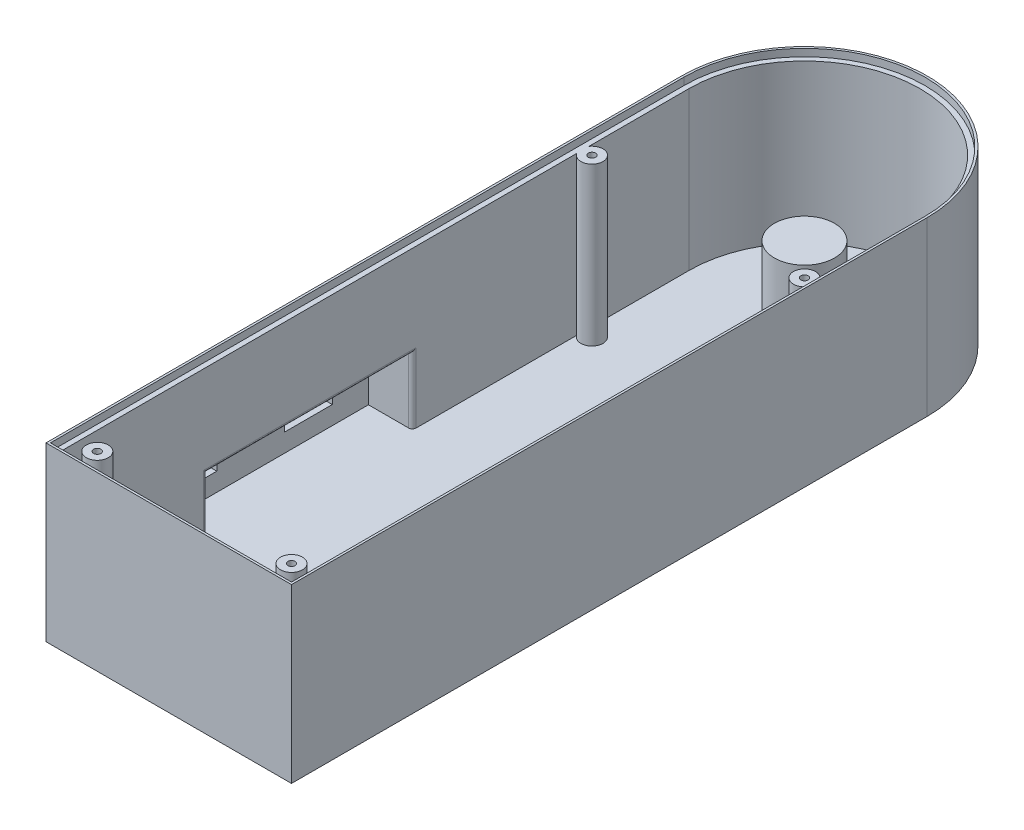
from build123d import *

# Parameters (mm, degrees)
SKETCH4_W                = 63
SKETCH4_H                = 43
BOSS_EXTRUDE2_DEPTH      = 173.5
SKETCH6_R                = 4
CUT_EXTRUDE1_DEPTH       = 3
SKETCH9_W                = 63
SKETCH9_H                = 43
CUT_EXTRUDE2_DEPTH       = 173.5
SKETCH10_R               = 8.2
BOSS_EXTRUDE3_DEPTH      = 22.8
SKETCH11_W               = 63
SKETCH11_H               = 43
BOSS_EXTRUDE4_DEPTH      = 2
SKETCH13_R               = 3
BOSS_EXTRUDE5_DEPTH      = 43
SKETCH14_R               = 1
CUT_EXTRUDE3_DEPTH       = 46
SKETCH15_R               = 4.3
CUT_EXTRUDE4_DEPTH       = 2
FILLET1_R                = 1
SKETCH19_R               = 6
CUT_EXTRUDE5_DEPTH       = 3
BOSS_EXTRUDE6_DEPTH      = 94
SKETCH21_W               = 37.035898385
SKETCH21_H               = 94
CUT_EXTRUDE6_DEPTH       = 13
FILLET2_R                = 1
BOSS_EXTRUDE8_DEPTH      = 2
SKETCH23_W               = 72.5
SKETCH23_H               = 25.3
CUT_EXTRUDE7_DEPTH       = 2
BOSS_EXTRUDE9_START      = -2
BOSS_EXTRUDE9_DEPTH      = 2
SKETCH25_R               = 3
BOSS_EXTRUDE10_DEPTH     = 48
SKETCH26_R               = 1
CUT_EXTRUDE8_DEPTH       = 46
SKETCH27_R               = 4.3
CUT_EXTRUDE9_DEPTH       = 2
FILLET3_R                = 1
SKETCH30_W               = 56
SKETCH30_H               = 18
CUT_EXTRUDE10_DEPTH      = 2
SKETCH31_W               = 60
SKETCH31_H               = 22
SKETCH31_W_2             = 56
SKETCH31_H_2             = 18
BOSS_EXTRUDE11_DEPTH     = 12
FILLET4_R                = 1
SKETCH33_W               = 56
SKETCH33_H               = 18
BOSS_EXTRUDE12_DEPTH     = 2
SKETCH34_W               = 1.256410256
SKETCH34_H               = 14
CUT_EXTRUDE11_DEPTH      = 1
SKETCH35_W               = 13.1
SKETCH35_H               = 12
SKETCH35_W_2             = 9.9
SKETCH35_H_2             = 11.8
CUT_EXTRUDE12_DEPTH      = 2
FILLET5_R                = 1
CUT_EXTRUDE13_DEPTH      = 186.67848556
CUT_EXTRUDE13_DEPTH_BACK = 3
FILLET6_R                = 1
SKETCH37_W               = 140.841687605
SKETCH37_H               = 2
BOSS_EXTRUDE13_DEPTH     = 4
FILLET8_R                = 2
SKETCH38_W               = 101.517619225
SKETCH38_H               = 238.576301881
CUT_EXTRUDE14_DEPTH      = 100
BOSS_EXTRUDE14_DEPTH     = 2


with BuildPart() as part:
    # Sketch1 → Revolve1 (revolve)
    with BuildSketch(Plane.XY, mode=Mode.PRIVATE) as revolve1_sk:
        Polygon((-31.5, 48), (-31.5, 50), (-33.5, 50), (-33.5, 0), (0, 0), (0, 24.8), (-8.2, 24.8), (-8.2, 2), (-31.5, 2), (-31.5, 45), (-4, 45), (-4, 48), align=None)
    revolve(revolve1_sk.sketch.rotate(Axis((0, 0, 0), (0, 1, 0)), 270), axis=Axis((0, 0, 0), (0, 1, 0)))

    # Sketch4 → Boss-Extrude2 (add)
    with BuildSketch(Plane.XY):
        Polygon((33.5, 0), (-33.5, 0), (-33.5, 48), (-31.5, 48), (31.5, 48), (33.5, 48), align=None)
        with Locations((0, 23.5)):
            Rectangle(SKETCH4_W, SKETCH4_H, mode=Mode.SUBTRACT)
    extrude(amount=BOSS_EXTRUDE2_DEPTH)

    # Sketch6 → Cut-Extrude1 (cut)
    with BuildSketch(Plane(origin=(0, 48, 0), x_dir=(1, 0, 0), z_dir=(0, 1, 0))):
        with Locations(Location((0, 0, 0), (0, 0, 90))):
            Circle(SKETCH6_R)
    extrude(amount=-CUT_EXTRUDE1_DEPTH, mode=Mode.SUBTRACT)

    # Sketch9 → Cut-Extrude2 (cut)
    with BuildSketch(Plane.XY.offset(173.5)):
        with Locations((0, 23.5)):
            Rectangle(SKETCH9_W, SKETCH9_H)
    extrude(amount=-CUT_EXTRUDE2_DEPTH, mode=Mode.SUBTRACT)

    # Sketch10 → Boss-Extrude3 (add)
    with BuildSketch(Plane(origin=(0, 2, 0), x_dir=(1, 0, 0), z_dir=(0, 1, 0))):
        with Locations(Location((0, 0, 0), (0, 0, 90))):
            Circle(SKETCH10_R)
    extrude(amount=BOSS_EXTRUDE3_DEPTH)

    # Sketch11 → Boss-Extrude4 (add)
    with BuildSketch(Plane.XY.offset(173.5)):
        with Locations((0, 23.5)):
            Rectangle(SKETCH11_W, SKETCH11_H)
    extrude(amount=-BOSS_EXTRUDE4_DEPTH)

    # Sketch13 → Boss-Extrude5 (add)
    with BuildSketch(Plane(origin=(0, 2, 0), x_dir=(1, 0, 0), z_dir=(0, 1, 0))):
        with Locations(Location((-26.5, -166.5, 0), (0, 0, 90))):
            Circle(SKETCH13_R)
        with Locations(Location((26.5, -166.5, 0), (0, 0, 90))):
            Circle(SKETCH13_R)
    extrude(amount=BOSS_EXTRUDE5_DEPTH)

    # Sketch14 → Cut-Extrude3 (cut)
    with BuildSketch(Plane(origin=(0, 2, 0), x_dir=(1, 0, 0), z_dir=(0, 1, 0))):
        with Locations(Location((-26.5, -166.5, 0), (0, 0, 270))):
            Circle(SKETCH14_R)
        with Locations(Location((26.5, -166.5, 0), (0, 0, 270))):
            Circle(SKETCH14_R)
    extrude(amount=CUT_EXTRUDE3_DEPTH, mode=Mode.SUBTRACT)

    # Sketch15 → Cut-Extrude4 (cut)
    with BuildSketch(Plane(origin=(0, 48, 0), x_dir=(1, 0, 0), z_dir=(0, 1, 0))):
        with Locations(Location((-26.5, -166.5, 0), (0, 0, 270))):
            Circle(SKETCH15_R)
        with Locations(Location((26.5, -166.5, 0), (0, 0, 270))):
            Circle(SKETCH15_R)
    extrude(amount=-CUT_EXTRUDE4_DEPTH, mode=Mode.SUBTRACT)

    # Fillet1
    fillet1_edges = [part.edges().sort_by_distance(p)[0] for p in [
        (-26.5, 46, 162.2),
        (26.5, 46, 162.2),
    ]]
    fillet(fillet1_edges, radius=FILLET1_R)

    # Sketch19 → Cut-Extrude5 (cut)
    with BuildSketch(Plane(origin=(0, 48, 0), x_dir=(1, 0, 0), z_dir=(0, 1, 0))):
        with Locations(Location((16.75, -51, 0), (0, 0, 270))):
            Circle(SKETCH19_R)
        with Locations(Location((16.75, -86, 0), (0, 0, 270))):
            Circle(SKETCH19_R)
        with Locations(Location((16.75, -121, 0), (0, 0, 270))):
            Circle(SKETCH19_R)
        with Locations(Location((16.75, -156, 0), (0, 0, 270))):
            Circle(SKETCH19_R)
    extrude(amount=-CUT_EXTRUDE5_DEPTH, mode=Mode.SUBTRACT)

    # Sketch20 → Boss-Extrude6 (add)
    with BuildSketch(Plane.XY.offset(56.5)):
        Polygon((9, 48), (-11.207259422, 83), (-33.5, 83), (-33.5, 48), align=None)
        Polygon((5.535898385, 50), (-12.36195996, 81), (-31.5, 81), (-31.5, 50), align=None, mode=Mode.SUBTRACT)
    extrude(amount=BOSS_EXTRUDE6_DEPTH)

    # Sketch21 → Cut-Extrude6 (cut)
    with BuildSketch(Plane(origin=(0, 50, 0), x_dir=(1, 0, 0), z_dir=(0, 1, 0))):
        with Locations((-12.982050808, -103.5)):
            Rectangle(SKETCH21_W, SKETCH21_H)
    extrude(amount=-CUT_EXTRUDE6_DEPTH, mode=Mode.SUBTRACT)

    # Fillet2
    fillet2_edges = [part.edges().sort_by_distance(p)[0] for p in [
        (-11.207259422, 83, 103.5),
        (-33.5, 83, 103.5),
    ]]
    fillet(fillet2_edges, radius=FILLET2_R)

    # Sketch22 → Boss-Extrude8 (add)
    with BuildSketch(Plane.XY.offset(150.5)):
        with BuildLine():
            Line((-33.5, 48), (-33.5, 45))
            Line((-33.5, 45), (9, 45))
            Line((9, 45), (9, 48))
            Line((9, 48), (-10.918584287, 82.5))
            ThreePointArc((-10.918584287, 82.5), (-11.284609691, 82.866025404), (-11.784609691, 83))
            Line((-11.784609691, 83), (-32.5, 83))
            ThreePointArc((-32.5, 83), (-33.207106781, 82.707106781), (-33.5, 82))
            Line((-33.5, 82), (-33.5, 48))
        make_face()
    extrude(amount=-BOSS_EXTRUDE8_DEPTH)

    # Sketch23 → Cut-Extrude7 (cut)
    with BuildSketch(Plane(origin=(27.534609691, 15.897114317, 0), x_dir=(0, 0, -1), z_dir=(0.8660254037844364, 0.5000000000000041, 0))):
        with Locations((-103.5, 54.719219382)):
            Rectangle(SKETCH23_W, SKETCH23_H)
    extrude(amount=-CUT_EXTRUDE7_DEPTH, mode=Mode.SUBTRACT)

    # Sketch24 → Boss-Extrude9 (add)
    with BuildSketch(Plane(origin=(0, 0, 56.5), x_dir=(-1, 0, 0), z_dir=(0, 0, -1)).offset(BOSS_EXTRUDE9_START)):
        with BuildLine():
            Line((-9, 48), (-9, 45))
            Line((-9, 45), (33.5, 45))
            Line((33.5, 45), (33.5, 82))
            ThreePointArc((33.5, 82), (33.207106781, 82.707106781), (32.5, 83))
            Line((32.5, 83), (11.784609691, 83))
            ThreePointArc((11.784609691, 83), (11.284609691, 82.866025404), (10.918584287, 82.5))
            Line((10.918584287, 82.5), (-9, 48))
        make_face()
    extrude(amount=BOSS_EXTRUDE9_DEPTH)

    # Sketch25 → Boss-Extrude10 (add)
    with BuildSketch(Plane(origin=(0, 48, 0), x_dir=(1, 0, 0), z_dir=(0, 1, 0))):
        with Locations((29, -29)):
            Circle(SKETCH25_R)
        with Locations((-29, -29)):
            Circle(SKETCH25_R)
    extrude(amount=-BOSS_EXTRUDE10_DEPTH)

    # Sketch26 → Cut-Extrude8 (cut)
    with BuildSketch(Plane(origin=(0, 48, 0), x_dir=(1, 0, 0), z_dir=(0, 1, 0))):
        with Locations(Location((29, -29, 0), (0, 0, 270))):
            Circle(SKETCH26_R)
        with Locations(Location((-29, -29, 0), (0, 0, 270))):
            Circle(SKETCH26_R)
    extrude(amount=-CUT_EXTRUDE8_DEPTH, mode=Mode.SUBTRACT)

    # Sketch27 → Cut-Extrude9 (cut)
    with BuildSketch(Plane(origin=(0, 48, 0), x_dir=(1, 0, 0), z_dir=(0, 1, 0))):
        with Locations(Location((-29, -29, 0), (0, 0, 270))):
            Circle(SKETCH27_R)
        with Locations(Location((29, -29, 0), (0, 0, 270))):
            Circle(SKETCH27_R)
    extrude(amount=-CUT_EXTRUDE9_DEPTH, mode=Mode.SUBTRACT)

    # Fillet3
    fillet3_edges = [part.edges().sort_by_distance(p)[0] for p in [
        (-29, 46, 24.7),
        (29, 46, 24.7),
    ]]
    fillet(fillet3_edges, radius=FILLET3_R)

    # Sketch30 → Cut-Extrude10 (cut)
    with BuildSketch(Plane.ZY.offset(33.5)):
        with Locations((103.5, 11)):
            Rectangle(SKETCH30_W, SKETCH30_H)
    extrude(amount=-CUT_EXTRUDE10_DEPTH, mode=Mode.SUBTRACT)

    # Sketch31 → Boss-Extrude11 (add)
    with BuildSketch(Plane.ZY.offset(33.5)):
        with Locations((103.5, 11)):
            Rectangle(SKETCH31_W, SKETCH31_H)
        with Locations((103.5, 11)):
            Rectangle(SKETCH31_W_2, SKETCH31_H_2, mode=Mode.SUBTRACT)
    extrude(amount=BOSS_EXTRUDE11_DEPTH)

    # Fillet4
    fillet4_edges = [part.edges().sort_by_distance(p)[0] for p in [
        (-33.5, 22, 103.5),
        (-33.5, 11, 73.5),
        (-33.5, 11, 133.5),
    ]]
    fillet(fillet4_edges, radius=FILLET4_R)

    # Sketch33 → Boss-Extrude12 (add)
    with BuildSketch(Plane.ZY.offset(45.5)):
        with Locations((103.5, 11)):
            Rectangle(SKETCH33_W, SKETCH33_H)
    extrude(amount=-BOSS_EXTRUDE12_DEPTH)

    # Sketch34 → Cut-Extrude11 (cut)
    # profile 1 of 6: a face of its own
    with BuildSketch(Plane(origin=(-88.690997647, 83, 0), x_dir=(0, 0, -1), z_dir=(0, -1, 0))):
        with Locations((-131.948717949, 66.906387956)):
            Rectangle(SKETCH34_W, SKETCH34_H)
    # profile 2 of 6: a face of its own
    with BuildSketch(Plane(origin=(-88.690997647, 83, 0), x_dir=(0, 0, -1), z_dir=(0, -1, 0))):
        with BuildLine():
            add(Edge.make_bspline(
                [(-127.282051282, 71.752541802), (-127.204036474, 71.757021384), (-127.05199672, 71.765751451), (-126.831838559, 71.829913099), (-126.630653738, 71.938172272), (-126.452556555, 72.086921483), (-126.304534975, 72.264507803), (-126.195030127, 72.46518156), (-126.127927486, 72.68597799), (-126.119633012, 72.84021095), (-126.115384615, 72.919208469)],
                knots=[0, 0, 0, 0, 1.020591893, 1.988988293, 2.974634352, 3.991697318, 5.008760285, 5.983632262, 6.967224335, 8, 8, 8, 8], degree=3))
            add(Edge.make_bspline(
                [(-126.115384615, 72.919208469), (-126.119787901, 72.996319721), (-126.128486105, 73.148644483), (-126.195061577, 73.367578068), (-126.30439614, 73.56847965), (-126.453493838, 73.745645733), (-126.6295776, 73.897974931), (-126.832476342, 74.004732003), (-127.051429094, 74.073595456), (-127.203934167, 74.081715722), (-127.282051282, 74.085875135)],
                knots=[0, 0, 0, 0, 1.010056097, 1.99525427, 2.971718109, 3.990441831, 5.01702829, 6.004283803, 6.977741589, 8, 8, 8, 8], degree=3))
            add(Edge.make_bspline(
                [(-127.282051282, 74.085875135), (-127.360112179, 74.081559045), (-127.513404007, 74.073083337), (-127.73317612, 74.006101082), (-127.934845679, 73.896933206), (-128.11097521, 73.745920643), (-128.258874388, 73.567557044), (-128.373284839, 73.368945884), (-128.434548495, 73.148011315), (-128.443950276, 72.996195002), (-128.448717949, 72.919208469)],
                knots=[0, 0, 0, 0, 1.021821805, 2.006599202, 2.982645994, 4.008793999, 5.027082625, 6.009034913, 6.990375297, 8, 8, 8, 8], degree=3))
            add(Edge.make_bspline(
                [(-128.448717949, 72.919208469), (-128.444092294, 72.840340078), (-128.435076647, 72.686621378), (-128.373312706, 72.463815008), (-128.258735298, 72.265431373), (-128.111909392, 72.086648721), (-127.933780412, 71.939197607), (-127.733801774, 71.828562965), (-127.51284526, 71.76625627), (-127.360012131, 71.757174469), (-127.282051282, 71.752541802)],
                knots=[0, 0, 0, 0, 1.032329927, 2.012066096, 2.992413168, 4.009037178, 5.025661188, 6.000112418, 6.979848586, 8, 8, 8, 8], degree=3))
        make_face()
    # profile 3 of 6: a face of its own
    with BuildSketch(Plane(origin=(-88.690997647, 83, 0), x_dir=(0, 0, -1), z_dir=(0, -1, 0))):
        Polygon((-122.884615385, 59.906387956), (-121.628205128, 59.906387956), (-121.628205128, 65.649977699), (-114.448717949, 65.649977699), (-114.448717949, 59.906387956), (-113.192307692, 59.906387956), (-113.192307692, 73.906387956), (-114.448717949, 73.906387956), (-114.448717949, 67.085875135), (-121.628205128, 67.085875135), (-121.628205128, 73.906387956), (-122.884615385, 73.906387956), align=None)
    # profile 4 of 6: a face of its own
    with BuildSketch(Plane(origin=(-88.690997647, 83, 0), x_dir=(0, 0, -1), z_dir=(0, -1, 0))):
        with BuildLine():
            Line((-99.551282051, 63.675618725), (-99.551282051, 73.906387956))
            Line((-99.551282051, 73.906387956), (-100.807692308, 73.906387956))
            Line((-100.807692308, 73.906387956), (-100.807692308, 72.136756545))
            add(Edge.make_bspline(
                [(-100.807692308, 72.136756545), (-100.949559408, 72.296694095), (-101.226826553, 72.609278391), (-101.685478933, 73.020163), (-102.175666693, 73.355630058), (-102.689038567, 73.627929327), (-103.229568228, 73.833193668), (-103.794081172, 73.977799853), (-104.382135708, 74.071868231), (-104.783157032, 74.081164279), (-104.986378205, 74.085875135)],
                knots=[0, 0, 0, 0, 1.074235403, 2.099501444, 3.086304576, 4.053325556, 5.01427503, 5.985443889, 6.979105517, 8, 8, 8, 8], degree=3))
            add(Edge.make_bspline(
                [(-104.986378205, 74.085875135), (-105.167050511, 74.08097046), (-105.523344299, 74.071298224), (-106.047453548, 73.996237304), (-106.551848614, 73.875758039), (-107.036850958, 73.707995401), (-107.499174292, 73.486612277), (-107.941423686, 73.21870812), (-108.36463127, 72.902801794), (-108.760748522, 72.540247251), (-109.125978444, 72.14687795), (-109.445517738, 71.726092193), (-109.716337693, 71.283669461), (-109.938903193, 70.8197341), (-110.111136046, 70.334625248), (-110.23096351, 69.828675698), (-110.305943543, 69.302727324), (-110.315610879, 68.944567704), (-110.320512821, 68.762958469)],
                knots=[0, 0, 0, 0, 1.034036272, 2.039165313, 3.024406509, 3.999331371, 4.971254918, 5.953351348, 6.95522652, 7.989525907, 9.023492927, 10.024309745, 11.009187477, 11.988246066, 12.964946762, 13.950187958, 14.960617622, 16, 16, 16, 16], degree=3))
            add(Edge.make_bspline(
                [(-110.320512821, 68.762958469), (-110.315502156, 68.585102896), (-110.305596342, 68.233492024), (-110.23176582, 67.716388188), (-110.107706917, 67.2182747), (-109.933274241, 66.740996758), (-109.710590389, 66.282632207), (-109.435112943, 65.846767298), (-109.115688796, 65.426734526), (-108.74655549, 65.036003596), (-108.34688294, 64.676390503), (-107.921307552, 64.359716463), (-107.475135823, 64.092499188), (-107.007473118, 63.875277522), (-106.5216309, 63.702659962), (-106.013918487, 63.582328903), (-105.48664475, 63.511593502), (-105.128686543, 63.501335053), (-104.947115385, 63.496131545)],
                knots=[0, 0, 0, 0, 1.02050356, 2.017480486, 2.990790918, 3.96161403, 4.928589988, 5.909588639, 6.91611943, 7.952353252, 8.989586576, 9.99823133, 10.991940466, 11.968822692, 12.952985106, 13.945868367, 14.958059758, 16, 16, 16, 16], degree=3))
            add(Edge.make_bspline(
                [(-104.947115385, 63.496131545), (-104.738311782, 63.501860959), (-104.328857772, 63.513096067), (-103.729112136, 63.607392592), (-103.161484658, 63.765224909), (-102.621058799, 63.980649759), (-102.115429291, 64.270750367), (-101.639735311, 64.629702222), (-101.199621142, 65.066207485), (-100.9405952, 65.398270363), (-100.807692308, 65.568647571)],
                knots=[0, 0, 0, 0, 1.038908319, 2.037250181, 3.012632028, 3.966567879, 4.9252131, 5.905168122, 6.925168603, 8, 8, 8, 8], degree=3))
            Line((-100.807692308, 65.568647571), (-100.807692308, 63.675618725))
            Line((-100.807692308, 63.675618725), (-99.551282051, 63.675618725))
        make_face()
        with BuildLine():
            add(Edge.make_bspline(
                [(-104.930288462, 64.752541802), (-105.113941971, 64.759081875), (-105.476444788, 64.771990938), (-106.008676356, 64.872605062), (-106.517721233, 65.040443519), (-107.002751616, 65.268659247), (-107.450376696, 65.560996553), (-107.857064896, 65.905684904), (-108.211791596, 66.306947393), (-108.511723002, 66.755564948), (-108.760721655, 67.233621452), (-108.932550065, 67.737000467), (-109.046679273, 68.252096677), (-109.058279678, 68.601563937), (-109.064102564, 68.776980904)],
                knots=[0, 0, 0, 0, 1.031179624, 2.035384561, 3.030098214, 4.035455833, 5.037557836, 6.024646278, 7.02156144, 8.035264006, 9.049836703, 10.039645228, 11.015989397, 12, 12, 12, 12], degree=3))
            add(Edge.make_bspline(
                [(-109.064102564, 68.776980904), (-109.05654374, 68.951306689), (-109.04145572, 69.299274959), (-108.936056281, 69.815160534), (-108.751049717, 70.315255398), (-108.507497803, 70.799474277), (-108.202845091, 71.251438033), (-107.848818519, 71.660109619), (-107.440066701, 72.010111329), (-106.988500009, 72.303274908), (-106.506714423, 72.539101452), (-105.999879604, 72.705430661), (-105.476829524, 72.810449466), (-105.120547678, 72.823105087), (-104.94150641, 72.829464879)],
                knots=[0, 0, 0, 0, 0.979235476, 1.954632679, 2.943119654, 3.967171814, 4.992637064, 5.997548408, 6.995574264, 8.005058949, 9.015076297, 9.999929117, 10.994910263, 12, 12, 12, 12], degree=3))
            add(Edge.make_bspline(
                [(-104.94150641, 72.829464879), (-104.759723293, 72.82284818), (-104.399094225, 72.809721692), (-103.865022351, 72.708413684), (-103.347692816, 72.538491195), (-102.851318684, 72.307106954), (-102.389689733, 72.020246776), (-101.97729874, 71.682924863), (-101.621032586, 71.296628225), (-101.327706123, 70.863665084), (-101.093342241, 70.394243496), (-100.927394835, 69.892855662), (-100.826604225, 69.362481009), (-100.814083445, 68.998983698), (-100.807692308, 68.813439238)],
                knots=[0, 0, 0, 0, 1.017730373, 2.019016736, 3.032373701, 4.060729657, 5.079187105, 6.068726676, 7.03591854, 8.011858086, 8.988317194, 9.965225429, 10.961364673, 12, 12, 12, 12], degree=3))
            add(Edge.make_bspline(
                [(-100.807692308, 68.813439238), (-100.811530994, 68.67208797), (-100.819086743, 68.393863944), (-100.876808154, 67.985353095), (-100.968631033, 67.594421044), (-101.098004164, 67.220639903), (-101.268012245, 66.866138453), (-101.472841465, 66.528137895), (-101.716693177, 66.209786658), (-101.992146351, 65.911487906), (-102.297054473, 65.64077053), (-102.621284743, 65.402162507), (-102.964021402, 65.200234462), (-103.325023868, 65.038639209), (-103.701511674, 64.906991608), (-104.097093385, 64.820040643), (-104.507782261, 64.760144848), (-104.787970212, 64.755102835), (-104.930288462, 64.752541802)],
                knots=[0, 0, 0, 0, 1.050062701, 2.066855696, 3.059271411, 4.030305351, 4.999747758, 5.975466543, 6.961907836, 7.974539719, 8.98812422, 9.98710676, 10.961662635, 11.93785114, 12.922015094, 13.919620009, 14.94329489, 16, 16, 16, 16], degree=3))
        make_face(mode=Mode.SUBTRACT)
    # profile 5 of 6: a face of its own
    with BuildSketch(Plane(origin=(-88.690997647, 83, 0), x_dir=(0, 0, -1), z_dir=(0, -1, 0))):
        with BuildLine():
            Line((-96.679487179, 63.675618725), (-95.423076923, 63.675618725))
            Line((-95.423076923, 63.675618725), (-95.423076923, 65.520971289))
            add(Edge.make_bspline(
                [(-95.423076923, 65.520971289), (-95.289157957, 65.353350137), (-95.029691705, 65.02858634), (-94.59314516, 64.60509757), (-94.137956996, 64.249722748), (-93.656734238, 63.969916172), (-93.154428772, 63.758297763), (-92.632465882, 63.605695951), (-92.088020434, 63.514140011), (-91.717760861, 63.502181358), (-91.530448718, 63.496131545)],
                knots=[0, 0, 0, 0, 1.127869841, 2.185233117, 3.191641716, 4.159226741, 5.10472073, 6.052603964, 7.014823782, 8, 8, 8, 8], degree=3))
            add(Edge.make_bspline(
                [(-91.530448718, 63.496131545), (-91.341035811, 63.502717968), (-90.970123229, 63.515615649), (-90.432020324, 63.629261075), (-89.925930257, 63.809105693), (-89.458620286, 64.061868442), (-89.037280928, 64.375689687), (-88.671907889, 64.743804343), (-88.364647734, 65.161777592), (-88.15956584, 65.553010358), (-88.02692105, 65.900525254), (-87.939752105, 66.197763901), (-87.869230571, 66.529058154), (-87.806040534, 66.893588904), (-87.763885841, 67.292820282), (-87.730470414, 67.725799431), (-87.706569282, 68.192451381), (-87.705618498, 68.515197399), (-87.705128205, 68.68162834)],
                knots=[0, 0, 0, 0, 1.235764162, 2.419900973, 3.574701258, 4.732869372, 5.875730734, 6.993815468, 8.107424371, 9.251605764, 9.866123335, 10.534503958, 11.272175692, 12.077112099, 12.949509943, 13.89253218, 14.913238789, 16, 16, 16, 16], degree=3))
            Line((-87.705128205, 68.68162834), (-87.705128205, 73.906387956))
            Line((-87.705128205, 73.906387956), (-88.961538462, 73.906387956))
            Line((-88.961538462, 73.906387956), (-88.961538462, 69.093887956))
            add(Edge.make_bspline(
                [(-88.961538462, 69.093887956), (-88.962308095, 68.954597976), (-88.963780274, 68.68815995), (-88.968484365, 68.306686454), (-88.979557576, 67.961664657), (-88.995757207, 67.652102998), (-89.018432601, 67.379134492), (-89.042707021, 67.141377431), (-89.07214832, 66.940937808), (-89.098401967, 66.820277635), (-89.110176282, 66.766163597)],
                knots=[0, 0, 0, 0, 1.430803381, 2.736883362, 3.918614142, 4.976458302, 5.92063272, 6.731858525, 7.431260095, 8, 8, 8, 8], degree=3))
            add(Edge.make_bspline(
                [(-89.110176282, 66.766163597), (-89.152467435, 66.60720474), (-89.233648341, 66.302071799), (-89.438328407, 65.888890398), (-89.69079908, 65.534265166), (-90.003604456, 65.245489432), (-90.368343351, 65.020684953), (-90.785622116, 64.864823406), (-91.251122123, 64.767308391), (-91.578541768, 64.757601307), (-91.749198718, 64.752541802)],
                knots=[0, 0, 0, 0, 1.084232, 2.08126119, 3.027460722, 3.945137793, 4.874029258, 5.839697328, 6.874011781, 8, 8, 8, 8], degree=3))
            add(Edge.make_bspline(
                [(-91.749198718, 64.752541802), (-91.850278792, 64.754417715), (-92.050313648, 64.758130098), (-92.346777346, 64.796345108), (-92.635253712, 64.856700904), (-92.914969902, 64.945850548), (-93.186491199, 65.05424406), (-93.450941222, 65.187247995), (-93.70462484, 65.348127535), (-93.951109207, 65.528956343), (-94.180206001, 65.730331925), (-94.396414837, 65.939748523), (-94.58638105, 66.165974926), (-94.758817282, 66.401012527), (-94.907487653, 66.649582736), (-95.037311441, 66.90902848), (-95.147451161, 67.179760147), (-95.202182341, 67.367659979), (-95.229567308, 67.461676417)],
                knots=[0, 0, 0, 0, 1.023939463, 2.026349741, 3.024227553, 4.007104963, 4.997624259, 5.984875705, 7.002218968, 8.038748769, 9.079772093, 10.091408226, 11.086177727, 12.069739863, 13.043026652, 14.017557731, 15.008077027, 16, 16, 16, 16], degree=3))
            add(Edge.make_bspline(
                [(-95.229567308, 67.461676417), (-95.245325902, 67.530697229), (-95.279631537, 67.680951927), (-95.316684257, 67.927529605), (-95.350314558, 68.212769505), (-95.378462393, 68.536338773), (-95.395684059, 68.899370273), (-95.414461646, 69.300313625), (-95.42129789, 69.740767578), (-95.422467306, 70.047414349), (-95.423076923, 70.207269366)],
                knots=[0, 0, 0, 0, 0.615963638, 1.340920617, 2.168419149, 3.115676021, 4.16674242, 5.331190069, 6.6087489, 8, 8, 8, 8], degree=3))
            Line((-95.423076923, 70.207269366), (-95.423076923, 73.906387956))
            Line((-95.423076923, 73.906387956), (-96.679487179, 73.906387956))
            Line((-96.679487179, 73.906387956), (-96.679487179, 63.675618725))
        make_face()
    # profile 6 of 6: a face of its own
    with BuildSketch(Plane(origin=(-88.690997647, 83, 0), x_dir=(0, 0, -1), z_dir=(0, -1, 0))):
        with BuildLine():
            Line((-74.423076923, 59.547413597), (-74.423076923, 73.906387956))
            Line((-74.423076923, 73.906387956), (-75.679487179, 73.906387956))
            Line((-75.679487179, 73.906387956), (-75.679487179, 72.136756545))
            add(Edge.make_bspline(
                [(-75.679487179, 72.136756545), (-75.82135428, 72.296694095), (-76.098621425, 72.609278391), (-76.557273805, 73.020163), (-77.047461565, 73.355630058), (-77.560833439, 73.627929327), (-78.101363099, 73.833193668), (-78.665876043, 73.977799853), (-79.25393058, 74.071868231), (-79.654951904, 74.081164279), (-79.858173077, 74.085875135)],
                knots=[0, 0, 0, 0, 1.074235403, 2.099501444, 3.086304576, 4.053325556, 5.01427503, 5.985443889, 6.979105517, 8, 8, 8, 8], degree=3))
            add(Edge.make_bspline(
                [(-79.858173077, 74.085875135), (-80.038845383, 74.08097046), (-80.395139171, 74.071298224), (-80.91924842, 73.996237304), (-81.423643486, 73.875758039), (-81.90864583, 73.707995401), (-82.370969164, 73.486612277), (-82.813218558, 73.21870812), (-83.236426142, 72.902801794), (-83.632543394, 72.540247251), (-83.997773316, 72.14687795), (-84.31731261, 71.726092193), (-84.588132565, 71.283669461), (-84.810698064, 70.8197341), (-84.982930918, 70.334625248), (-85.102758382, 69.828675698), (-85.177738414, 69.302727324), (-85.187405751, 68.944567704), (-85.192307692, 68.762958469)],
                knots=[0, 0, 0, 0, 1.034036272, 2.039165313, 3.024406509, 3.999331371, 4.971254918, 5.953351348, 6.95522652, 7.989525907, 9.023492927, 10.024309745, 11.009187477, 11.988246066, 12.964946762, 13.950187958, 14.960617622, 16, 16, 16, 16], degree=3))
            add(Edge.make_bspline(
                [(-85.192307692, 68.762958469), (-85.187297028, 68.585102896), (-85.177391214, 68.233492024), (-85.103560692, 67.716388188), (-84.979501789, 67.2182747), (-84.805069113, 66.740996758), (-84.582385261, 66.282632207), (-84.306907815, 65.846767298), (-83.987483668, 65.426734526), (-83.618350361, 65.036003596), (-83.218677812, 64.676390503), (-82.793102423, 64.359716463), (-82.346930695, 64.092499188), (-81.879267989, 63.875277522), (-81.393425772, 63.702659962), (-80.885713359, 63.582328903), (-80.358439621, 63.511593502), (-80.000481415, 63.501335053), (-79.818910256, 63.496131545)],
                knots=[0, 0, 0, 0, 1.02050356, 2.017480486, 2.990790918, 3.96161403, 4.928589988, 5.909588639, 6.91611943, 7.952353252, 8.989586576, 9.99823133, 10.991940466, 11.968822692, 12.952985106, 13.945868367, 14.958059758, 16, 16, 16, 16], degree=3))
            add(Edge.make_bspline(
                [(-79.818910256, 63.496131545), (-79.610011355, 63.502290764), (-79.199966026, 63.514380625), (-78.600202205, 63.618863482), (-78.030823851, 63.786104789), (-77.49185283, 64.023662608), (-76.98802002, 64.333257117), (-76.512590236, 64.705577492), (-76.072848113, 65.149983962), (-75.812606589, 65.484482914), (-75.679487179, 65.655586674)],
                knots=[0, 0, 0, 0, 1.03083325, 2.023411113, 2.996083796, 3.9549903, 4.922369457, 5.908572979, 6.930187902, 8, 8, 8, 8], degree=3))
            Line((-75.679487179, 65.655586674), (-75.679487179, 59.547413597))
            Line((-75.679487179, 59.547413597), (-74.423076923, 59.547413597))
        make_face()
        with BuildLine():
            add(Edge.make_bspline(
                [(-79.802083333, 64.752541802), (-79.985736843, 64.759081875), (-80.34823966, 64.771990938), (-80.880471228, 64.872605062), (-81.389516104, 65.040443519), (-81.874546487, 65.268659247), (-82.322171568, 65.560996553), (-82.728859768, 65.905684904), (-83.083586468, 66.306947393), (-83.383517874, 66.755564948), (-83.632516527, 67.233621452), (-83.804344936, 67.737000467), (-83.918474145, 68.252096677), (-83.93007455, 68.601563937), (-83.935897436, 68.776980904)],
                knots=[0, 0, 0, 0, 1.031179624, 2.035384561, 3.030098214, 4.035455833, 5.037557836, 6.024646278, 7.02156144, 8.035264006, 9.049836703, 10.039645228, 11.015989397, 12, 12, 12, 12], degree=3))
            add(Edge.make_bspline(
                [(-83.935897436, 68.776980904), (-83.928338612, 68.951306689), (-83.913250592, 69.299274959), (-83.807851153, 69.815160534), (-83.622844589, 70.315255398), (-83.379292675, 70.799474277), (-83.074639963, 71.251438033), (-82.72061339, 71.660109619), (-82.311861573, 72.010111329), (-81.860294881, 72.303274908), (-81.378509295, 72.539101452), (-80.871674476, 72.705430661), (-80.348624396, 72.810449466), (-79.99234255, 72.823105087), (-79.813301282, 72.829464879)],
                knots=[0, 0, 0, 0, 0.979235476, 1.954632679, 2.943119654, 3.967171814, 4.992637064, 5.997548408, 6.995574264, 8.005058949, 9.015076297, 9.999929117, 10.994910263, 12, 12, 12, 12], degree=3))
            add(Edge.make_bspline(
                [(-79.813301282, 72.829464879), (-79.631518165, 72.82284818), (-79.270889097, 72.809721692), (-78.736817223, 72.708413684), (-78.219487688, 72.538491195), (-77.723113556, 72.307106954), (-77.261484605, 72.020246776), (-76.849093611, 71.682924863), (-76.492827458, 71.296628225), (-76.199500994, 70.863665084), (-75.965137113, 70.394243496), (-75.799189707, 69.892855662), (-75.698399097, 69.362481009), (-75.685878317, 68.998983698), (-75.679487179, 68.813439238)],
                knots=[0, 0, 0, 0, 1.017730373, 2.019016736, 3.032373701, 4.060729657, 5.079187105, 6.068726676, 7.03591854, 8.011858086, 8.988317194, 9.965225429, 10.961364673, 12, 12, 12, 12], degree=3))
            add(Edge.make_bspline(
                [(-75.679487179, 68.813439238), (-75.683325866, 68.67208797), (-75.690881615, 68.393863944), (-75.748603026, 67.985353095), (-75.840425905, 67.594421044), (-75.969799036, 67.220639903), (-76.139807117, 66.866138453), (-76.344636337, 66.528137895), (-76.588488049, 66.209786658), (-76.863941223, 65.911487906), (-77.168849344, 65.64077053), (-77.493079615, 65.402162507), (-77.835816274, 65.200234462), (-78.19681874, 65.038639209), (-78.573306545, 64.906991608), (-78.968888256, 64.820040643), (-79.379577132, 64.760144848), (-79.659765083, 64.755102835), (-79.802083333, 64.752541802)],
                knots=[0, 0, 0, 0, 1.050062701, 2.066855696, 3.059271411, 4.030305351, 4.999747758, 5.975466543, 6.961907836, 7.974539719, 8.98812422, 9.98710676, 10.961662635, 11.93785114, 12.922015094, 13.919620009, 14.94329489, 16, 16, 16, 16], degree=3))
        make_face(mode=Mode.SUBTRACT)
    extrude(amount=CUT_EXTRUDE11_DEPTH, mode=Mode.SUBTRACT)

    # Sketch35 → Cut-Extrude12 (cut)
    with BuildSketch(Plane.ZY.offset(45.5)):
        with Locations((91.925, 13)):
            Rectangle(SKETCH35_W, SKETCH35_H)
        with Locations((121.825, 12.9)):
            Rectangle(SKETCH35_W_2, SKETCH35_H_2)
    extrude(amount=-CUT_EXTRUDE12_DEPTH, mode=Mode.SUBTRACT)

    # Fillet5
    fillet5_edges = [part.edges().sort_by_distance(p)[0] for p in [
        (-45.5, 22, 103.5),
        (-45.5, 11, 73.5),
        (-45.5, 11, 133.5),
    ]]
    fillet(fillet5_edges, radius=FILLET5_R)

    # Sketch36 → Cut-Extrude13 (cut, two sides: drawn at the far end of the back side and taken through both)
    with BuildSketch(Plane(origin=(0, 48, 0), x_dir=(1, 0, 0), z_dir=(0, 1, 0)).offset(-CUT_EXTRUDE13_DEPTH_BACK)):
        with BuildLine():
            Line((0, -34.893159234), (0, -38.893159234))
            ThreePointArc((0, -38.893159234), (10.633828773, -37.522467598), (20.57248383, -33.5))
            Line((20.57248383, -33.5), (20.57248383, -28.208754037))
            ThreePointArc((20.57248383, -28.208754037), (10.815594803, -33.180137304), (0, -34.893159234))
        make_face()
        with BuildLine():
            ThreePointArc((0, -38.893159234), (-10.633828773, -37.522467598), (-20.57248383, -33.5))
            Line((-20.57248383, -33.5), (-20.57248383, -28.208754037))
            ThreePointArc((-20.57248383, -28.208754037), (-10.815594803, -33.180137304), (0, -34.893159234))
            Line((0, -34.893159234), (0, -38.893159234))
        make_face()
    extrude(amount=CUT_EXTRUDE13_DEPTH + CUT_EXTRUDE13_DEPTH_BACK, mode=Mode.SUBTRACT)

    # Fillet6
    fillet6_edges = [part.edges().sort_by_distance(p)[0] for p in [
        (-31.5, 20, 103.5),
        (-31.5, 11, 131.5),
        (-31.5, 11, 75.5),
    ]]
    fillet(fillet6_edges, radius=FILLET6_R)

    # Sketch37 → Boss-Extrude13 (add)
    with BuildSketch(Plane.ZY.offset(-31.5)):
        with Locations((101.079156197, 34.5)):
            Rectangle(SKETCH37_W, SKETCH37_H)
        with Locations((101.079156197, 30.4)):
            Rectangle(SKETCH37_W, SKETCH37_H)
    extrude(amount=BOSS_EXTRUDE13_DEPTH)

    # Fillet8
    fillet8_edges = [part.edges().sort_by_distance(p)[0] for p in [
        (31.5, 29.4, 101.079156198),
    ]]
    fillet(fillet8_edges, radius=FILLET8_R - 0.0001)  # a hair under: the kernel refuses the full size

    # Sketch38 → Cut-Extrude14 (cut)
    with BuildSketch(Plane(origin=(0, 45, 0), x_dir=(-1, 0, 0), z_dir=(0, -1, 0))):
        with Locations((3.929818551, -78.457251398)):
            Rectangle(SKETCH38_W, SKETCH38_H)
    extrude(amount=-CUT_EXTRUDE14_DEPTH, mode=Mode.SUBTRACT)

    # Sketch39 → Boss-Extrude14 (add)
    with BuildSketch(Plane(origin=(0, 45, 0), x_dir=(1, 0, 0), z_dir=(0, 1, 0))):
        with BuildLine():
            Line((33.5, 0), (33.5, -173.5))
            Line((33.5, -173.5), (-33.5, -173.5))
            Line((-33.5, -173.5), (-33.5, 0))
            ThreePointArc((-33.5, 0), (0, 33.5), (33.5, 0))
        make_face()
        with BuildLine():
            Line((-32.9, -172.9), (-32.9, 0))
            ThreePointArc((-32.9, 0), (0, 32.9), (32.9, 0))
            Line((32.9, 0), (32.9, -172.9))
            Line((32.9, -172.9), (-32.9, -172.9))
        make_face(mode=Mode.SUBTRACT)
    extrude(amount=BOSS_EXTRUDE14_DEPTH)


solid = part.part
